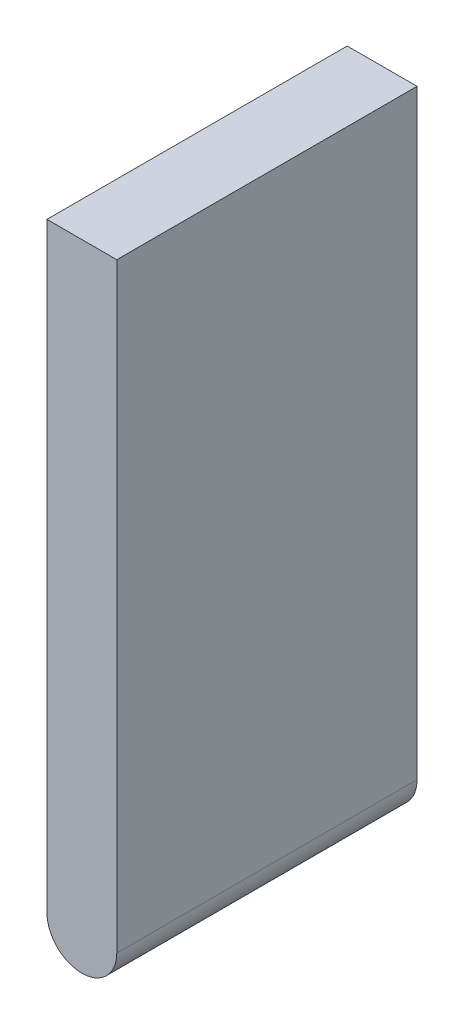
from build123d import *

# Parameters (mm, degrees)
SKETCH1_R           = 75
BOSS_EXTRUDE1_DEPTH = 645
SKETCH2_W           = 150
SKETCH2_H           = 645
BOSS_EXTRUDE2_DEPTH = 1290


with BuildPart() as part:
    # Sketch1 → Boss-Extrude1 (new body)
    with BuildSketch(Plane.XY):
        Circle(SKETCH1_R)
    extrude(amount=BOSS_EXTRUDE1_DEPTH)

    # Sketch2 → Boss-Extrude2 (add)
    with BuildSketch(Plane(origin=(0, 0, 0), x_dir=(1, 0, 0), z_dir=(0, 1, 0))):
        with Locations((0, -322.5)):
            Rectangle(SKETCH2_W, SKETCH2_H)
    extrude(amount=BOSS_EXTRUDE2_DEPTH)


solid = part.part
